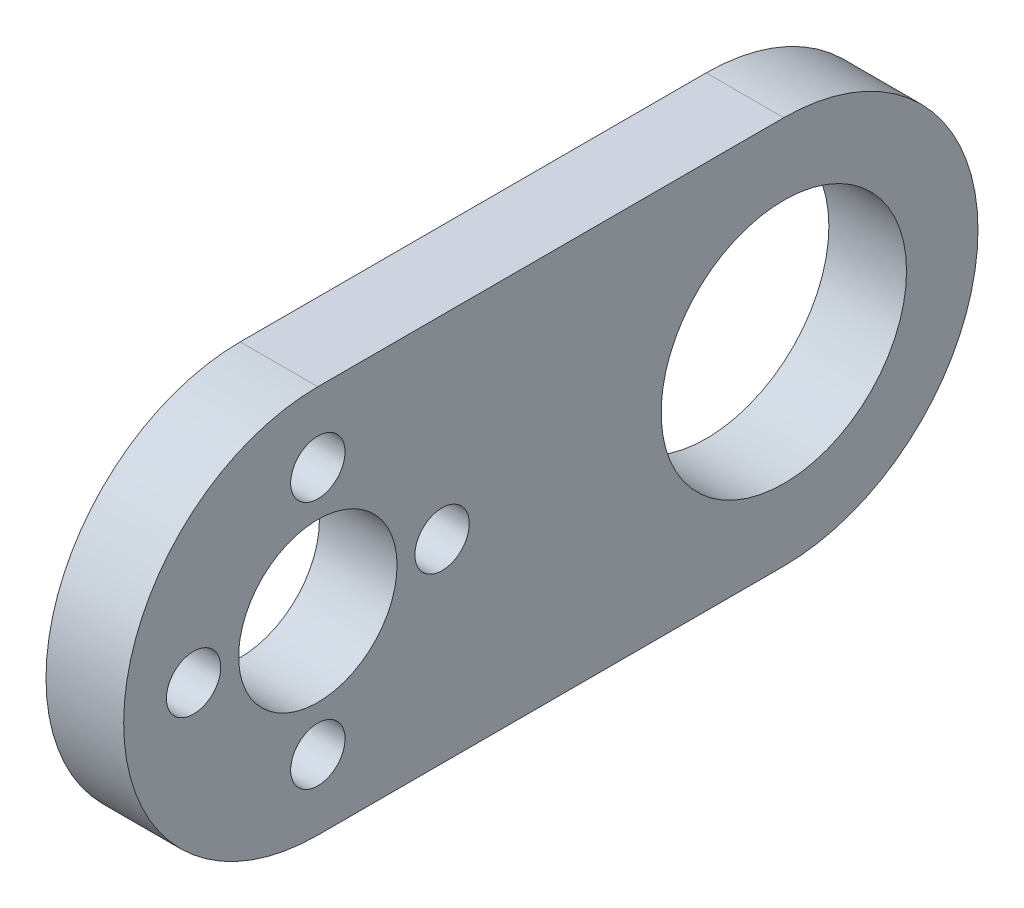
from build123d import *

# Parameters (mm, degrees)
CROQUIS1_R              = 7.9
CROQUIS1_R_2            = 5.1
CROQUIS1_R_3            = 1.75
SALIENTE_EXTRUIR1_DEPTH = 5


with BuildPart() as part:
    # Croquis1 → Saliente-Extruir1 (new body)
    with BuildSketch(Plane(origin=(0, 0, 0), x_dir=(0, 0, -1), z_dir=(1, 0, 0))):
        with BuildLine():
            Line((-15, -12.5), (15, -12.5))
            ThreePointArc((15, -12.5), (27.5, 0), (15, 12.5))
            Line((15, 12.5), (-15, 12.5))
            ThreePointArc((-15, 12.5), (-27.5, 0), (-15, -12.5))
        make_face()
        with Locations((15, 0)):
            Circle(CROQUIS1_R, mode=Mode.SUBTRACT)
        with Locations((-15, 0)):
            Circle(CROQUIS1_R_2, mode=Mode.SUBTRACT)
        with Locations((-23, 0)):
            Circle(CROQUIS1_R_3, mode=Mode.SUBTRACT)
        with Locations((-15, 8)):
            Circle(CROQUIS1_R_3, mode=Mode.SUBTRACT)
        with Locations((-7, 0)):
            Circle(CROQUIS1_R_3, mode=Mode.SUBTRACT)
        with Locations((-15, -8)):
            Circle(CROQUIS1_R_3, mode=Mode.SUBTRACT)
    extrude(amount=SALIENTE_EXTRUIR1_DEPTH)


solid = part.part
